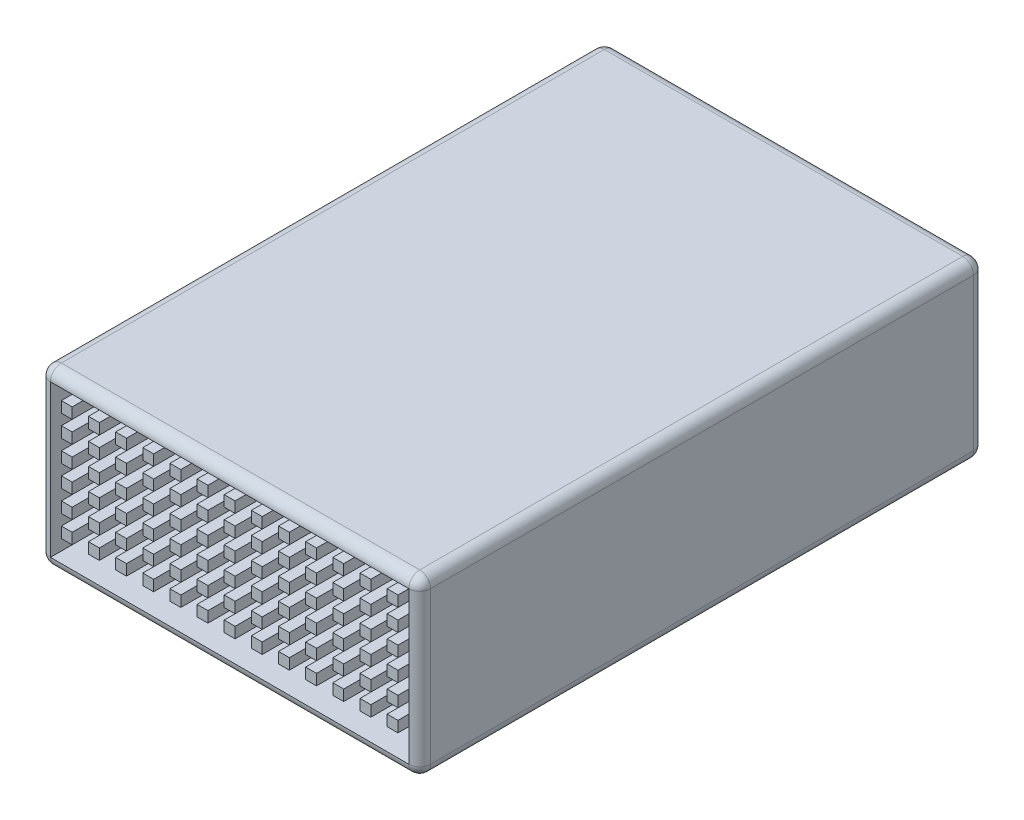
from build123d import *

# Parameters (mm, degrees)
SKETCH1_W           = 35
SKETCH1_H           = 52
BOSS_EXTRUDE1_DEPTH = 16
SKETCH2_W           = 33
SKETCH2_H           = 14
SKETCH2_W_2         = 1
SKETCH2_H_2         = 1
CUT_EXTRUDE1_DEPTH  = 15
FILLET1_R           = 1


with BuildPart() as part:
    # Sketch1 → Boss-Extrude1 (new body)
    with BuildSketch(Plane(origin=(0, 0, 0), x_dir=(1, 0, 0), z_dir=(0, 1, 0))):
        Rectangle(SKETCH1_W, SKETCH1_H)
    extrude(amount=BOSS_EXTRUDE1_DEPTH)

    # Sketch2 → Cut-Extrude1 (cut)
    with BuildSketch(Plane.XY.offset(26)):
        with Locations((0, 8)):
            Rectangle(SKETCH2_W, SKETCH2_H)
        with Locations((-12.5, 13.5)):
            Rectangle(SKETCH2_W_2, SKETCH2_H_2, mode=Mode.SUBTRACT)
        with Locations((-15, 13.5)):
            Rectangle(SKETCH2_W_2, SKETCH2_H_2, mode=Mode.SUBTRACT)
        with Locations((-10, 13.5)):
            Rectangle(SKETCH2_W_2, SKETCH2_H_2, mode=Mode.SUBTRACT)
        with Locations((-7.5, 13.5)):
            Rectangle(SKETCH2_W_2, SKETCH2_H_2, mode=Mode.SUBTRACT)
        with Locations((-5, 13.5)):
            Rectangle(SKETCH2_W_2, SKETCH2_H_2, mode=Mode.SUBTRACT)
        with Locations((-2.5, 13.5)):
            Rectangle(SKETCH2_W_2, SKETCH2_H_2, mode=Mode.SUBTRACT)
        with Locations((0, 13.5)):
            Rectangle(SKETCH2_W_2, SKETCH2_H_2, mode=Mode.SUBTRACT)
        with Locations((2.5, 13.5)):
            Rectangle(SKETCH2_W_2, SKETCH2_H_2, mode=Mode.SUBTRACT)
        with Locations((5, 13.5)):
            Rectangle(SKETCH2_W_2, SKETCH2_H_2, mode=Mode.SUBTRACT)
        with Locations((7.5, 13.5)):
            Rectangle(SKETCH2_W_2, SKETCH2_H_2, mode=Mode.SUBTRACT)
        with Locations((10, 13.5)):
            Rectangle(SKETCH2_W_2, SKETCH2_H_2, mode=Mode.SUBTRACT)
        with Locations((12.5, 13.5)):
            Rectangle(SKETCH2_W_2, SKETCH2_H_2, mode=Mode.SUBTRACT)
        with Locations((15, 13.5)):
            Rectangle(SKETCH2_W_2, SKETCH2_H_2, mode=Mode.SUBTRACT)
        with Locations((15, 11.5)):
            Rectangle(SKETCH2_W_2, SKETCH2_H_2, mode=Mode.SUBTRACT)
        with Locations((12.5, 11.5)):
            Rectangle(SKETCH2_W_2, SKETCH2_H_2, mode=Mode.SUBTRACT)
        with Locations((10, 11.5)):
            Rectangle(SKETCH2_W_2, SKETCH2_H_2, mode=Mode.SUBTRACT)
        with Locations((7.5, 11.5)):
            Rectangle(SKETCH2_W_2, SKETCH2_H_2, mode=Mode.SUBTRACT)
        with Locations((5, 11.5)):
            Rectangle(SKETCH2_W_2, SKETCH2_H_2, mode=Mode.SUBTRACT)
        with Locations((2.5, 11.5)):
            Rectangle(SKETCH2_W_2, SKETCH2_H_2, mode=Mode.SUBTRACT)
        with Locations((-5, 11.5)):
            Rectangle(SKETCH2_W_2, SKETCH2_H_2, mode=Mode.SUBTRACT)
        with Locations((-7.5, 11.5)):
            Rectangle(SKETCH2_W_2, SKETCH2_H_2, mode=Mode.SUBTRACT)
        with Locations((-10, 11.5)):
            Rectangle(SKETCH2_W_2, SKETCH2_H_2, mode=Mode.SUBTRACT)
        with Locations((-12.5, 11.5)):
            Rectangle(SKETCH2_W_2, SKETCH2_H_2, mode=Mode.SUBTRACT)
        with Locations((0, 11.5)):
            Rectangle(SKETCH2_W_2, SKETCH2_H_2, mode=Mode.SUBTRACT)
        with Locations((-2.5, 11.5)):
            Rectangle(SKETCH2_W_2, SKETCH2_H_2, mode=Mode.SUBTRACT)
        with Locations((-15, 11.5)):
            Rectangle(SKETCH2_W_2, SKETCH2_H_2, mode=Mode.SUBTRACT)
        with Locations((15, 9.5)):
            Rectangle(SKETCH2_W_2, SKETCH2_H_2, mode=Mode.SUBTRACT)
        with Locations((12.5, 9.5)):
            Rectangle(SKETCH2_W_2, SKETCH2_H_2, mode=Mode.SUBTRACT)
        with Locations((10, 9.5)):
            Rectangle(SKETCH2_W_2, SKETCH2_H_2, mode=Mode.SUBTRACT)
        with Locations((7.5, 9.5)):
            Rectangle(SKETCH2_W_2, SKETCH2_H_2, mode=Mode.SUBTRACT)
        with Locations((5, 9.5)):
            Rectangle(SKETCH2_W_2, SKETCH2_H_2, mode=Mode.SUBTRACT)
        with Locations((2.5, 9.5)):
            Rectangle(SKETCH2_W_2, SKETCH2_H_2, mode=Mode.SUBTRACT)
        with Locations((-5, 9.5)):
            Rectangle(SKETCH2_W_2, SKETCH2_H_2, mode=Mode.SUBTRACT)
        with Locations((-7.5, 9.5)):
            Rectangle(SKETCH2_W_2, SKETCH2_H_2, mode=Mode.SUBTRACT)
        with Locations((-10, 9.5)):
            Rectangle(SKETCH2_W_2, SKETCH2_H_2, mode=Mode.SUBTRACT)
        with Locations((-12.5, 9.5)):
            Rectangle(SKETCH2_W_2, SKETCH2_H_2, mode=Mode.SUBTRACT)
        with Locations((0, 9.5)):
            Rectangle(SKETCH2_W_2, SKETCH2_H_2, mode=Mode.SUBTRACT)
        with Locations((-2.5, 9.5)):
            Rectangle(SKETCH2_W_2, SKETCH2_H_2, mode=Mode.SUBTRACT)
        with Locations((-15, 9.5)):
            Rectangle(SKETCH2_W_2, SKETCH2_H_2, mode=Mode.SUBTRACT)
        with Locations((15, 7.5)):
            Rectangle(SKETCH2_W_2, SKETCH2_H_2, mode=Mode.SUBTRACT)
        with Locations((12.5, 7.5)):
            Rectangle(SKETCH2_W_2, SKETCH2_H_2, mode=Mode.SUBTRACT)
        with Locations((10, 7.5)):
            Rectangle(SKETCH2_W_2, SKETCH2_H_2, mode=Mode.SUBTRACT)
        with Locations((7.5, 7.5)):
            Rectangle(SKETCH2_W_2, SKETCH2_H_2, mode=Mode.SUBTRACT)
        with Locations((5, 7.5)):
            Rectangle(SKETCH2_W_2, SKETCH2_H_2, mode=Mode.SUBTRACT)
        with Locations((2.5, 7.5)):
            Rectangle(SKETCH2_W_2, SKETCH2_H_2, mode=Mode.SUBTRACT)
        with Locations((-5, 7.5)):
            Rectangle(SKETCH2_W_2, SKETCH2_H_2, mode=Mode.SUBTRACT)
        with Locations((-7.5, 7.5)):
            Rectangle(SKETCH2_W_2, SKETCH2_H_2, mode=Mode.SUBTRACT)
        with Locations((-10, 7.5)):
            Rectangle(SKETCH2_W_2, SKETCH2_H_2, mode=Mode.SUBTRACT)
        with Locations((-12.5, 7.5)):
            Rectangle(SKETCH2_W_2, SKETCH2_H_2, mode=Mode.SUBTRACT)
        with Locations((0, 7.5)):
            Rectangle(SKETCH2_W_2, SKETCH2_H_2, mode=Mode.SUBTRACT)
        with Locations((-2.5, 7.5)):
            Rectangle(SKETCH2_W_2, SKETCH2_H_2, mode=Mode.SUBTRACT)
        with Locations((-15, 7.5)):
            Rectangle(SKETCH2_W_2, SKETCH2_H_2, mode=Mode.SUBTRACT)
        with Locations((15, 5.5)):
            Rectangle(SKETCH2_W_2, SKETCH2_H_2, mode=Mode.SUBTRACT)
        with Locations((12.5, 5.5)):
            Rectangle(SKETCH2_W_2, SKETCH2_H_2, mode=Mode.SUBTRACT)
        with Locations((10, 5.5)):
            Rectangle(SKETCH2_W_2, SKETCH2_H_2, mode=Mode.SUBTRACT)
        with Locations((7.5, 5.5)):
            Rectangle(SKETCH2_W_2, SKETCH2_H_2, mode=Mode.SUBTRACT)
        with Locations((5, 5.5)):
            Rectangle(SKETCH2_W_2, SKETCH2_H_2, mode=Mode.SUBTRACT)
        with Locations((2.5, 5.5)):
            Rectangle(SKETCH2_W_2, SKETCH2_H_2, mode=Mode.SUBTRACT)
        with Locations((-5, 5.5)):
            Rectangle(SKETCH2_W_2, SKETCH2_H_2, mode=Mode.SUBTRACT)
        with Locations((-7.5, 5.5)):
            Rectangle(SKETCH2_W_2, SKETCH2_H_2, mode=Mode.SUBTRACT)
        with Locations((-10, 5.5)):
            Rectangle(SKETCH2_W_2, SKETCH2_H_2, mode=Mode.SUBTRACT)
        with Locations((-12.5, 5.5)):
            Rectangle(SKETCH2_W_2, SKETCH2_H_2, mode=Mode.SUBTRACT)
        with Locations((0, 5.5)):
            Rectangle(SKETCH2_W_2, SKETCH2_H_2, mode=Mode.SUBTRACT)
        with Locations((-2.5, 5.5)):
            Rectangle(SKETCH2_W_2, SKETCH2_H_2, mode=Mode.SUBTRACT)
        with Locations((-15, 5.5)):
            Rectangle(SKETCH2_W_2, SKETCH2_H_2, mode=Mode.SUBTRACT)
        with Locations((15, 3.5)):
            Rectangle(SKETCH2_W_2, SKETCH2_H_2, mode=Mode.SUBTRACT)
        with Locations((12.5, 3.5)):
            Rectangle(SKETCH2_W_2, SKETCH2_H_2, mode=Mode.SUBTRACT)
        with Locations((10, 3.5)):
            Rectangle(SKETCH2_W_2, SKETCH2_H_2, mode=Mode.SUBTRACT)
        with Locations((7.5, 3.5)):
            Rectangle(SKETCH2_W_2, SKETCH2_H_2, mode=Mode.SUBTRACT)
        with Locations((5, 3.5)):
            Rectangle(SKETCH2_W_2, SKETCH2_H_2, mode=Mode.SUBTRACT)
        with Locations((2.5, 3.5)):
            Rectangle(SKETCH2_W_2, SKETCH2_H_2, mode=Mode.SUBTRACT)
        with Locations((-5, 3.5)):
            Rectangle(SKETCH2_W_2, SKETCH2_H_2, mode=Mode.SUBTRACT)
        with Locations((-7.5, 3.5)):
            Rectangle(SKETCH2_W_2, SKETCH2_H_2, mode=Mode.SUBTRACT)
        with Locations((-10, 3.5)):
            Rectangle(SKETCH2_W_2, SKETCH2_H_2, mode=Mode.SUBTRACT)
        with Locations((-12.5, 3.5)):
            Rectangle(SKETCH2_W_2, SKETCH2_H_2, mode=Mode.SUBTRACT)
        with Locations((0, 3.5)):
            Rectangle(SKETCH2_W_2, SKETCH2_H_2, mode=Mode.SUBTRACT)
        with Locations((-2.5, 3.5)):
            Rectangle(SKETCH2_W_2, SKETCH2_H_2, mode=Mode.SUBTRACT)
        with Locations((-15, 3.5)):
            Rectangle(SKETCH2_W_2, SKETCH2_H_2, mode=Mode.SUBTRACT)
    extrude(amount=-CUT_EXTRUDE1_DEPTH, mode=Mode.SUBTRACT)

    # Fillet1
    fillet1_edges = [part.edges().sort_by_distance(p)[0] for p in [
        (17.5, 16, 0),
        (0, 16, -26),
        (-17.5, 16, 0),
        (0, 0, -26),
        (17.5, 0, 0),
        (0, 0, 26),
        (-17.5, 0, 0),
        (0, 16, 26),
        (-17.5, 8, -26),
        (17.5, 8, -26),
        (17.5, 8, 26),
        (-17.5, 8, 26),
    ]]
    fillet(fillet1_edges, radius=FILLET1_R - 0.0001)  # a hair under: the kernel refuses the full size


solid = part.part
